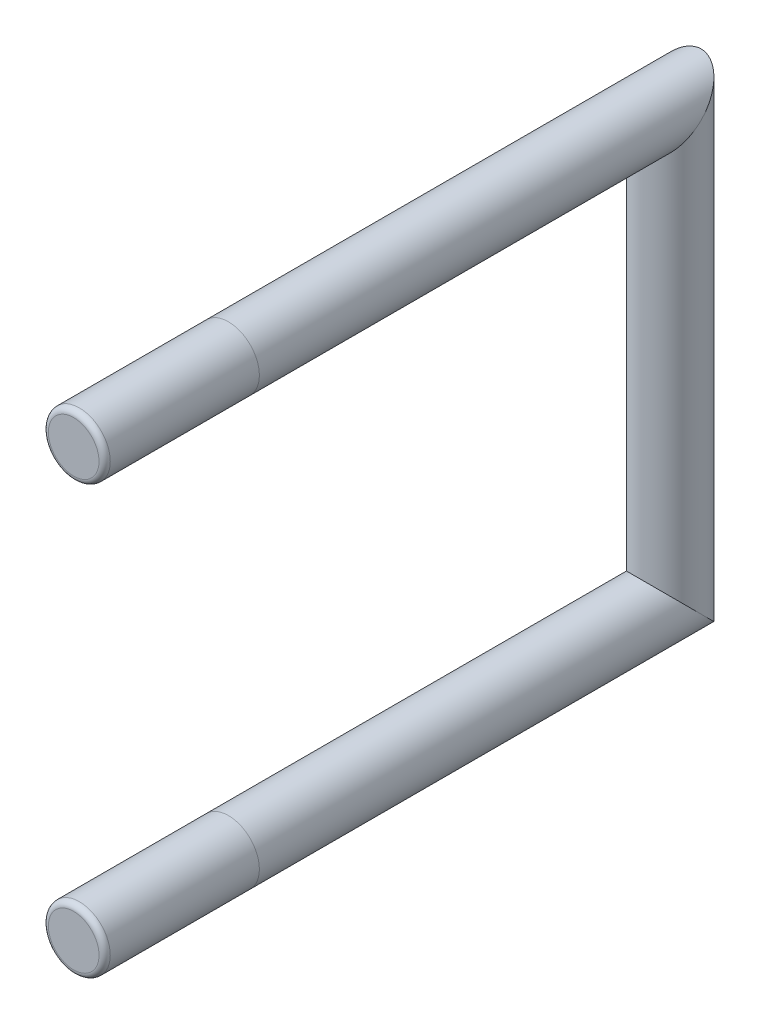
from build123d import *

# Parameters (mm, degrees)
SKETCH_1_R             = 11
EXTRUDE_1_DEPTH        = 157
SKETCH_2_R             = 11
EXTRUDE_2_DEPTH        = 152
PATTERN_LINEAR_1_COUNT = 2
PATTERN_LINEAR_1_PITCH = 152
CHAMFER_3_SIZE         = 21.999
SKETCH_3_R             = 10.9995
EXTRUDE_3_DEPTH        = 55
FILLET_1_R             = 2


with BuildPart() as part:
    # 草图1 → 拉伸1 (new body)
    with BuildSketch(Plane.XY):
        Circle(SKETCH_1_R)
    extrude_1 = extrude(amount=EXTRUDE_1_DEPTH)

    # 草图2 → 拉伸2 (add)
    with BuildSketch(Plane(origin=(0, 0, 0), x_dir=(1, 0, 0), z_dir=(0, 1, 0))):
        with Locations(Location((0, 0, 0), (0, 0, 180))):
            Circle(SKETCH_2_R)
    extrude(amount=EXTRUDE_2_DEPTH)

    # 阵列(线性)1: 拉伸1 ×2
    with Locations(*[(0, i * PATTERN_LINEAR_1_PITCH, 0) for i in range(1, PATTERN_LINEAR_1_COUNT)]):
        add(extrude_1)

    # 倒角3
    # the kernel refuses this chamfer: 21.999 mm, written as the material it adds along each edge
    with BuildSketch(Plane(origin=(67.574454052, 0, 0), x_dir=(0, -0.9996219169112966, 0.027495876610586372), z_dir=(-1, 0, 0))) as chamfer_3_piece_1_section:
        Polygon((CHAMFER_3_SIZE * 0.999621916911, -CHAMFER_3_SIZE * 0.0274958766106), (-CHAMFER_3_SIZE * 0.0274958766106, -CHAMFER_3_SIZE * 0.999621916911), (0, 0), align=None)
    chamfer_3_piece_1 = extrude(amount=135.148908105, mode=Mode.PRIVATE)
    chamfer_3_piece_1 = chamfer_3_piece_1 & Plane(origin=(0, 0, -4.859651136), x_dir=(1, 0, 0), z_dir=(0, 0, -1)) * Cylinder(11, 359, mode=Mode.PRIVATE)
    chamfer_3_piece_1 = chamfer_3_piece_1 & Plane(origin=(0, -4.859651136, 0), x_dir=(-1, 0, 0), z_dir=(0, -1, 0)) * Cylinder(11, 359, mode=Mode.PRIVATE)
    add(chamfer_3_piece_1)
    with BuildSketch(Plane(origin=(-67.574454052, 152, 0), x_dir=(0, -0.027495876610586986, -0.9996219169112966), z_dir=(1, 0, 0))) as chamfer_3_piece_2_section:
        Polygon((CHAMFER_3_SIZE * 0.999621916911, CHAMFER_3_SIZE * 0.0274958766106), (-CHAMFER_3_SIZE * 0.0274958766106, CHAMFER_3_SIZE * 0.999621916911), (0, 0), align=None)
    chamfer_3_piece_2 = extrude(amount=135.148908105, mode=Mode.PRIVATE)
    chamfer_3_piece_2 = chamfer_3_piece_2 & Plane(origin=(0, 156.859651136, 0), x_dir=(-1, 0, 0), z_dir=(0, -1, 0)) * Cylinder(11, 359, mode=Mode.PRIVATE)
    chamfer_3_piece_2 = chamfer_3_piece_2 & Plane(origin=(0, 152, -4.859651136), x_dir=(1, 0, 0), z_dir=(0, 0, -1)) * Cylinder(11, 359, mode=Mode.PRIVATE)
    add(chamfer_3_piece_2)

    # 草图3 → 拉伸3 (add)
    with BuildSketch(Plane.XY.offset(157)):
        with Locations((0, 152)):
            Circle(SKETCH_3_R)
        Circle(SKETCH_3_R)
    extrude(amount=EXTRUDE_3_DEPTH)

    # 圆角1
    fillet_1_edges = [part.edges().sort_by_distance(p)[0] for p in [
        (-10.9995, 152, 212),
        (-10.9995, 0, 212),
    ]]
    fillet(fillet_1_edges, radius=FILLET_1_R)


solid = part.part
